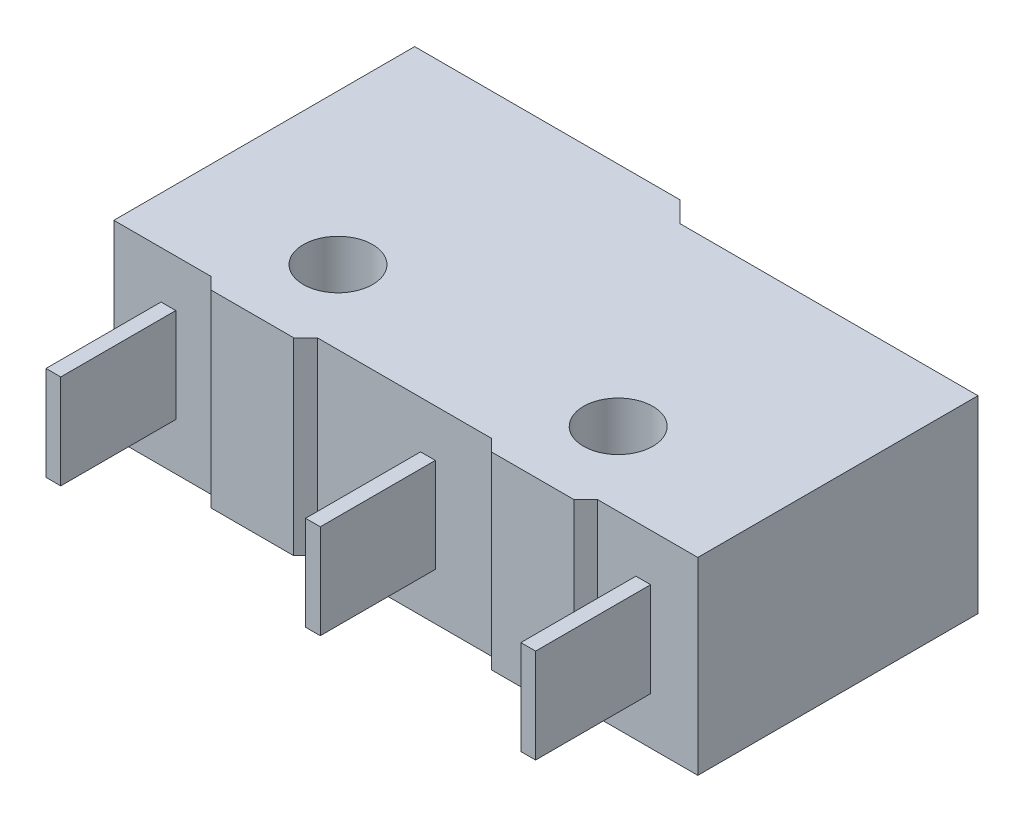
from build123d import *

# Parameters (mm, degrees)
SKETCH2_R                = 1.175
BOSS_EXTRUDE1_DEPTH      = 6.4
BOSS_EXTRUDE2_DEPTH      = 1.6
BOSS_EXTRUDE2_DEPTH_BACK = 1.6
BOSS_EXTRUDE3_DEPTH      = 1.6
BOSS_EXTRUDE3_DEPTH_BACK = 1.6
SKETCH4_W                = 0.5
SKETCH4_H                = 3.9


with BuildPart() as part:
    # Sketch2 → Boss-Extrude1 (new body)
    with BuildSketch(Plane(origin=(0, 0, 0), x_dir=(1, 0, 0), z_dir=(0, 1, 0))):
        Polygon((0, -2.9), (-1.4, -2.9), (-1.8, -2.5), (-5.1, -2.5), (-5.1, 7.7), (3.9, 7.7), (4.6, 7), (14.7, 7), (14.7, -2.5), (11.3, -2.5), (10.9, -2.9), (9.5, -2.9), (8.1, -2.9), (7.7, -2.5), (1.8, -2.5), (1.4, -2.9), align=None)
        Circle(SKETCH2_R, mode=Mode.SUBTRACT)
        with Locations((9.5, 0)):
            Circle(SKETCH2_R, mode=Mode.SUBTRACT)
    extrude(amount=BOSS_EXTRUDE1_DEPTH)

    # Sketch3 → Boss-Extrude2 (add, two sides: drawn at the far end of the back side and taken through both)
    with BuildSketch(Plane(origin=(0, 3.2, 0), x_dir=(1, 0, 0), z_dir=(0, 1, 0)).offset(-BOSS_EXTRUDE2_DEPTH_BACK)):
        with BuildLine():
            Line((3, 7.7), (1, 7.7))
            Line((1, 7.7), (1, 7.954))
            add(Edge.make_bspline(
                [(1, 7.954), (2, 9.1224), (3, 7.954)],
                knots=[0, 0, 0, 1, 1, 1], degree=2))
            Line((3, 7.954), (3, 7.7))
        make_face()
    extrude(amount=BOSS_EXTRUDE2_DEPTH + BOSS_EXTRUDE2_DEPTH_BACK)

    # Sketch4 → Boss-Extrude3 (add, two sides: drawn at the far end of the back side and taken through both)
    with BuildSketch(Plane(origin=(0, 3.2, 0), x_dir=(1, 0, 0), z_dir=(0, 1, 0)).offset(-BOSS_EXTRUDE3_DEPTH_BACK)):
        with Locations((-3.25, -4.45)):
            Rectangle(SKETCH4_W, SKETCH4_H)
        with Locations((5.55, -4.45)):
            Rectangle(SKETCH4_W, SKETCH4_H)
        with Locations((12.85, -4.45)):
            Rectangle(SKETCH4_W, SKETCH4_H)
    extrude(amount=BOSS_EXTRUDE3_DEPTH + BOSS_EXTRUDE3_DEPTH_BACK)


solid = part.part
